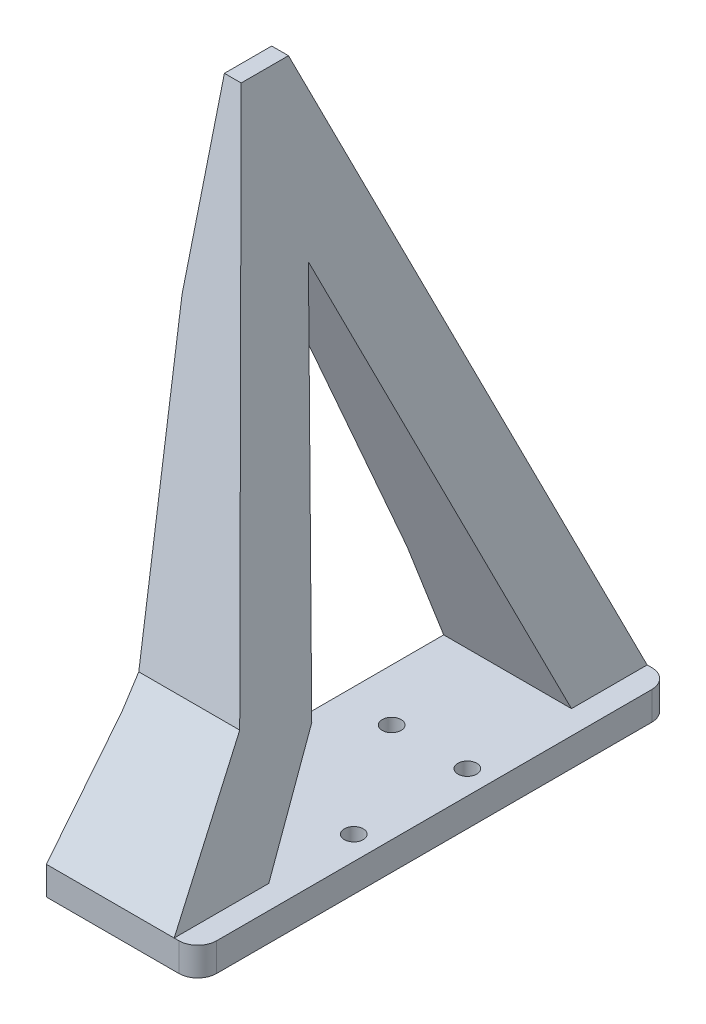
from build123d import *

# Parameters (mm, degrees)
SKETCH_1_R          = 1
EXTRUDE_1_DEPTH     = 3
SKETCH_2_W          = 16.007753667
SKETCH_2_H          = 50
EXTRUDE_2_DEPTH     = 80
CUT_EXTRUDE_1_DEPTH = 89.149011211
CUT_EXTRUDE_2_DEPTH = 81.960252593
EXTRUDE_3_DEPTH     = 3
CUT_EXTRUDE_3_DEPTH = 82.357621032


with BuildPart() as part:
    # 草图1 → 凸台-拉伸1 (new body)
    with BuildSketch(Plane(origin=(0, 0, 0), x_dir=(1, 0, 0), z_dir=(0, 1, 0))):
        with BuildLine():
            Line((-9.25, 25), (7.25, 25))
            ThreePointArc((7.25, 25), (8.664213562, 24.414213562), (9.25, 23))
            Line((9.25, 23), (9.25, -23))
            ThreePointArc((9.25, -23), (8.664213562, -24.414213562), (7.25, -25))
            Line((7.25, -25), (-9.25, -25))
            Line((-9.25, -25), (-9.25, 25))
        make_face()
        with Locations((-1.25, 6)):
            Circle(SKETCH_1_R, mode=Mode.SUBTRACT)
        with Locations((-1.25, -6)):
            Circle(SKETCH_1_R, mode=Mode.SUBTRACT)
        with Locations((6.75, -6)):
            Circle(SKETCH_1_R, mode=Mode.SUBTRACT)
        with Locations((6.75, 6)):
            Circle(SKETCH_1_R, mode=Mode.SUBTRACT)
    extrude(amount=EXTRUDE_1_DEPTH)

    # 草图2 → 凸台-拉伸2 (add)
    with BuildSketch(Plane(origin=(0, 3, 0), x_dir=(1, 0, 0), z_dir=(0, 1, 0))):
        with Locations((-1.246123166, 0)):
            Rectangle(SKETCH_2_W, SKETCH_2_H)
    extrude(amount=EXTRUDE_2_DEPTH)

    # 草图3 → 切除-拉伸1 (cut, through all)
    with BuildSketch(Plane(origin=(6.757753667, 0, 0), x_dir=(0, 0, -1), z_dir=(1, 0, 0))):
        Polygon((-25, 3), (-15, 15.5), (-3.181818182, 63), (1.818181818, 63), (25, 3), (32.784332669, 3), (32.784332669, 88.133626677), (-39.086773644, 88.133626677), (-39.086773644, 3), align=None)
        Polygon((-15, 3), (-8, 13), (0, 47), (17, 3), align=None)
    extrude(amount=-CUT_EXTRUDE_1_DEPTH, mode=Mode.SUBTRACT)

    # 草图4 → 切除-拉伸2 (cut, through all)
    with BuildSketch(Plane.XY.offset(25)):
        Polygon((6.757753667, 3), (6.757753667, 67.763295657), (-9.14963747, 67.763295657), align=None)
    extrude(amount=-CUT_EXTRUDE_2_DEPTH, mode=Mode.SUBTRACT)

    # 草图5 → 凸台-拉伸3 (add)
    with BuildSketch(Plane.ZY.offset(9.25)):
        Polygon((-1.818181818, 63), (-25, 3), (-25, 0), (25, 0), (25, 3), (15, 15.5), (3.181818182, 63), align=None)
        Polygon((0, 47), (-17, 3), (15, 3), (8, 13), align=None, mode=Mode.SUBTRACT)
    extrude(amount=EXTRUDE_3_DEPTH)

    # 草图6 → 切除-拉伸3 (cut, through all)
    with BuildSketch(Plane(origin=(0, 0, -25), x_dir=(-1, 0, 0), z_dir=(0, 0, -1))):
        Polygon((6.75, 0), (6.75, 13), (9.75, 45), (9.75, 64.870972757), (14.09361996, 64.870972757), (14.09361996, 0), align=None)
    extrude(amount=-CUT_EXTRUDE_3_DEPTH, mode=Mode.SUBTRACT)


solid = part.part
